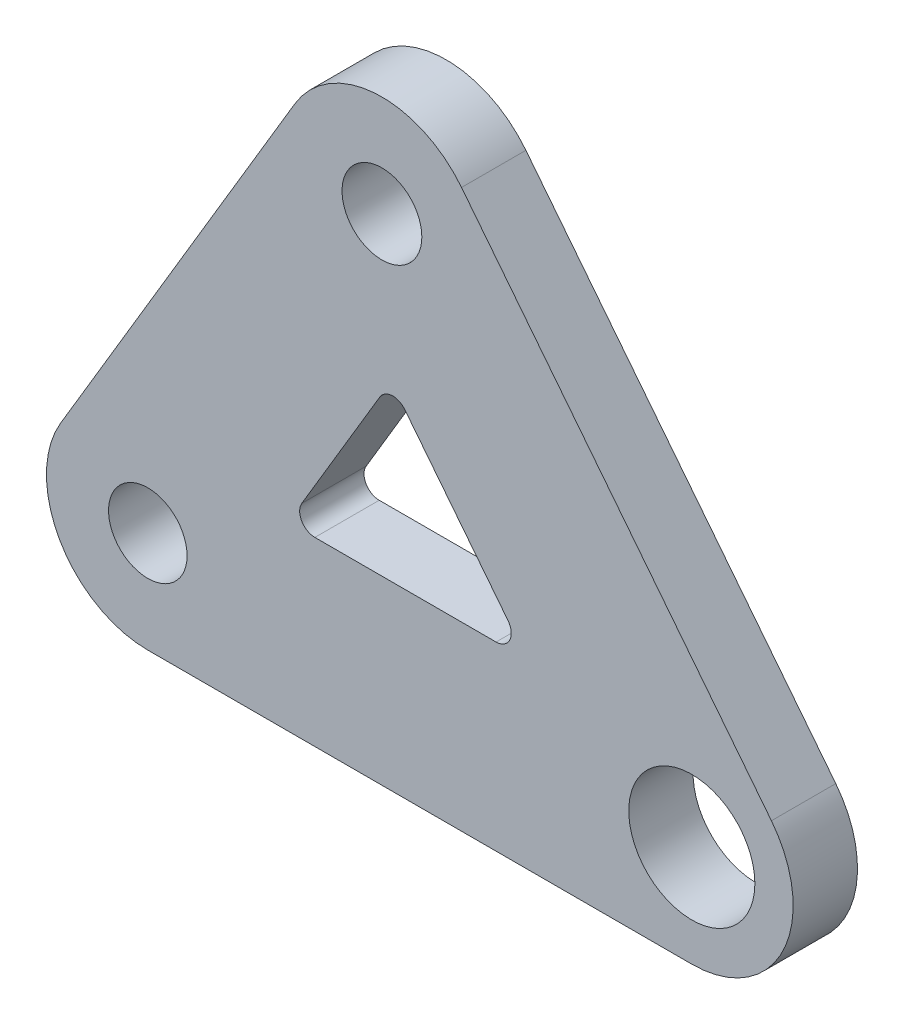
from build123d import *

# Parameters (mm, degrees)
SKETCH1_R           = 3.9375
SKETCH1_R_2         = 6.223
SKETCH1_R_3         = 3.875
BOSS_EXTRUDE1_DEPTH = 6.35
FILLET1_R           = 1.5


with BuildPart() as part:
    # Sketch1 → Boss-Extrude1 (new body)
    with BuildSketch(Plane.XY):
        with BuildLine():
            Line((-8.593850937, 5.113289165), (-31.697797638, -33.717269329))
            ThreePointArc((-31.697797638, -33.717269329), (-31.796842986, -43.773589363), (-23.103946701, -48.830558493))
            Line((-23.103946701, -48.830558493), (30.579912659, -48.830558493))
            ThreePointArc((30.579912659, -48.830558493), (39.576298559, -43.196911746), (38.436192426, -32.643566638))
            Line((38.436192426, -32.643566638), (7.856279768, 6.186991855))
            ThreePointArc((7.856279768, 6.186991855), (-0.651315725, 9.978766849), (-8.593850937, 5.113289165))
        make_face()
        Polygon((-9.254840748, -30.955558493), (0.905857228, -13.878581033), (14.354349844, -30.955558493), align=None, mode=Mode.SUBTRACT)
        Circle(SKETCH1_R, mode=Mode.SUBTRACT)
        with Locations((30.579912659, -38.830558493)):
            Circle(SKETCH1_R_2, mode=Mode.SUBTRACT)
        with Locations((-23.103946701, -38.830558493)):
            Circle(SKETCH1_R_3, mode=Mode.SUBTRACT)
    extrude(amount=BOSS_EXTRUDE1_DEPTH)

    # Fillet1
    fillet1_edges = [part.edges().sort_by_distance(p)[0] for p in [
        (14.354349844, -30.955558493, 3.175),
        (0.905857228, -13.878581033, 3.175),
        (-9.254840748, -30.955558493, 3.175),
    ]]
    fillet(fillet1_edges, radius=FILLET1_R)


solid = part.part
